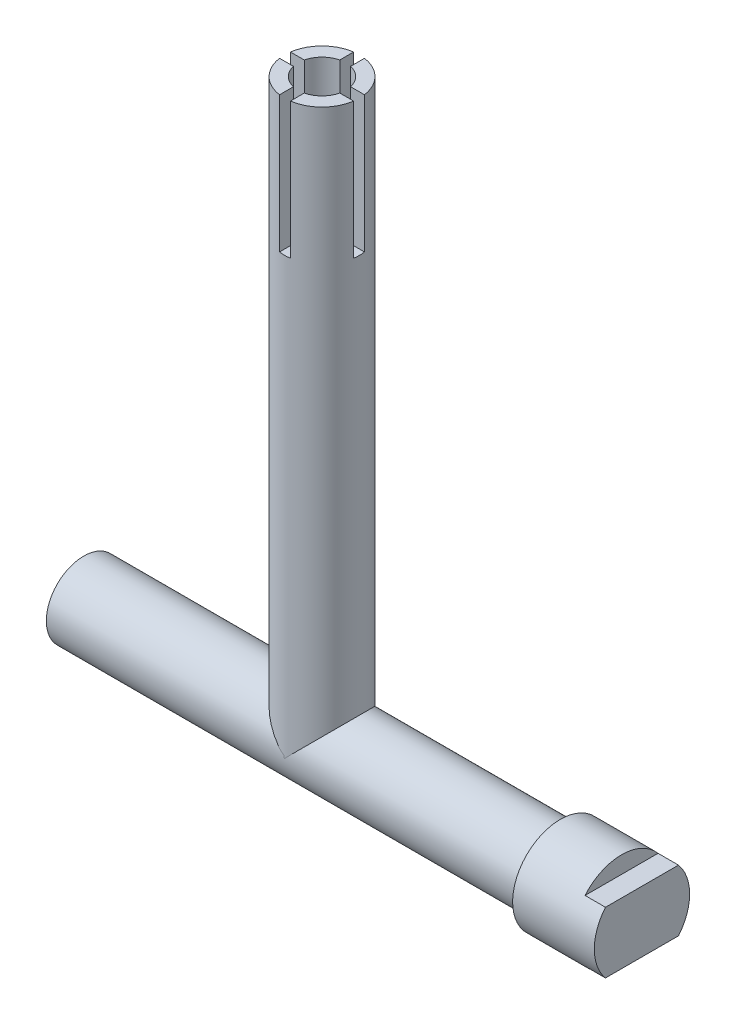
from build123d import *

# Parameters (mm, degrees)
SKETCH_1_R                 = 2.75
EXTRUDE_1_DEPTH            = 35
SKETCH_2_R                 = 2.75
EXTRUDE_2_DEPTH            = 42
SKETCH_4_W                 = 0.8
SKETCH_4_H                 = 0.8
CUT_EXTRUDE_1_DEPTH        = 10
SKETCH_5_R                 = 3.5
EXTRUDE_3_DEPTH            = 6
CUT_EXTRUDE_START          = -1.5
CUT_EXTRUDE_2_DEPTH        = 1.5
SKETCH_7_R                 = 2
CUT_EXTRUDE_3_DEPTH        = 7
SPLIT_START                = 14
SPLIT_BODIES_1_DEPTH       = 7
SPLIT_BODIES_1_2_OUTLINE_R = 2.75
SPLIT_BODIES_1_2_DEPTH     = 2.75
SPLIT_BODIES_1_3_DEPTH     = 7


with BuildPart() as part:
    # Эскиз1 → Бобышка-Вытянуть1 (new body)
    with BuildSketch(Plane(origin=(0, 0, 0), x_dir=(0, 0, -1), z_dir=(1, 0, 0))):
        Circle(SKETCH_1_R)
    extrude(amount=EXTRUDE_1_DEPTH)

    # Эскиз5 → Бобышка-Вытянуть3 (add)
    with BuildSketch(Plane(origin=(35, 0, 0), x_dir=(0, 0, -1), z_dir=(1, 0, 0))):
        Circle(SKETCH_5_R)
    extrude(amount=EXTRUDE_3_DEPTH)

    # Эскиз6 → Вырез-Вытянуть2 (cut)
    with BuildSketch(Plane(origin=(41, 0, 0), x_dir=(0, 0, -1), z_dir=(1, 0, 0)).offset(CUT_EXTRUDE_START)):
        with BuildLine():
            ThreePointArc((2.680951324, 2.25), (0, 3.5), (-2.680951324, 2.25))
            Line((-2.680951324, 2.25), (2.680951324, 2.25))
        make_face()
        with BuildLine():
            Line((2.680951324, -2.25), (-2.680951324, -2.25))
            ThreePointArc((-2.680951324, -2.25), (0, -3.5), (2.680951324, -2.25))
        make_face()
    extrude(amount=CUT_EXTRUDE_2_DEPTH, mode=Mode.SUBTRACT)

    # Эскиз7 → Вырез-Вытянуть3 (cut)
    with BuildSketch(Plane.ZY):
        Circle(SKETCH_7_R)
    extrude(amount=-CUT_EXTRUDE_3_DEPTH, mode=Mode.SUBTRACT)

    # Эскиз8 → Отверстие обработанное метчиком M2.5x0.451 (revolve, cut)
    with BuildSketch(Plane(origin=(7, 0, 0), x_dir=(0, 0, 1), z_dir=(0, 1, 0))):
        Polygon((0, 0), (0, 6.615882135), (1.025, 6), (1.025, 0), align=None)
    revolve(axis=Axis((0.65, 0, 0), (1, 0, 0)), mode=Mode.SUBTRACT)


with BuildPart() as body_2:
    # Эскиз2 → Бобышка-Вытянуть2 (new body)
    with BuildSketch(Plane(origin=(0, 0, 0), x_dir=(1, 0, 0), z_dir=(0, 1, 0))):
        with Locations(Location((17.5, 0, 0), (0, 0, 90))):
            Circle(SKETCH_2_R)
    extrude(amount=EXTRUDE_2_DEPTH)

    # Эскиз3 → Диаметр отверстия Ø3.5 (3.5)1 (revolve, cut)
    with BuildSketch(Plane(origin=(17.5, 42, 0), x_dir=(0, 0, 1), z_dir=(1, 0, 0))):
        Polygon((0, 0), (0, 14.051506083), (1.75, 13), (1.75, 0), align=None)
    revolve(axis=Axis((17.5, 48.35, 0), (0, -1, 0)), mode=Mode.SUBTRACT)

    # Эскиз4 → Вырез-Вытянуть1 (cut)
    with BuildSketch(Plane(origin=(0, 42, 0), x_dir=(1, 0, 0), z_dir=(0, 1, 0))):
        with BuildLine():
            Line((17.1, 4), (17.1, 2.720753572))
            ThreePointArc((17.1, 2.720753572), (17.5, 2.75), (17.9, 2.720753572))
            Line((17.9, 2.720753572), (17.9, 4))
            Line((17.9, 4), (17.1, 4))
        make_face()
        with BuildLine():
            Line((17.1, -1.703672504), (17.1, -2.720753572))
            ThreePointArc((17.1, -2.720753572), (17.5, -2.75), (17.9, -2.720753572))
            Line((17.9, -2.720753572), (17.9, -1.703672504))
            ThreePointArc((17.9, -1.703672504), (17.5, -1.75), (17.1, -1.703672504))
        make_face()
        with BuildLine():
            ThreePointArc((17.9, 2.720753572), (17.5, 2.75), (17.1, 2.720753572))
            Line((17.1, 2.720753572), (17.1, 1.703672504))
            ThreePointArc((17.1, 1.703672504), (17.5, 1.75), (17.9, 1.703672504))
            Line((17.9, 1.703672504), (17.9, 2.720753572))
        make_face()
        with BuildLine():
            Line((17.1, 1.703672504), (17.1, 0.4))
            Line((17.1, 0.4), (17.9, 0.4))
            Line((17.9, 0.4), (17.9, 1.703672504))
            ThreePointArc((17.9, 1.703672504), (17.5, 1.75), (17.1, 1.703672504))
        make_face()
        with Locations((17.5, 0)):
            Rectangle(SKETCH_4_W, SKETCH_4_H)
        with BuildLine():
            Line((15.796327496, -0.4), (17.1, -0.4))
            Line((17.1, -0.4), (17.1, 0.4))
            Line((17.1, 0.4), (15.796327496, 0.4))
            ThreePointArc((15.796327496, 0.4), (15.75, 0), (15.796327496, -0.4))
        make_face()
        with BuildLine():
            ThreePointArc((14.779246428, 0.4), (14.75, 0), (14.779246428, -0.4))
            Line((14.779246428, -0.4), (15.796327496, -0.4))
            ThreePointArc((15.796327496, -0.4), (15.75, 0), (15.796327496, 0.4))
            Line((15.796327496, 0.4), (14.779246428, 0.4))
        make_face()
        with BuildLine():
            Line((19.203672504, -0.4), (20.220753572, -0.4))
            ThreePointArc((20.220753572, -0.4), (20.242678647, -0.200533883), (20.25, 0))
            ThreePointArc((20.25, 0), (20.242678647, 0.200533883), (20.220753572, 0.4))
            Line((20.220753572, 0.4), (19.203672504, 0.4))
            ThreePointArc((19.203672504, 0.4), (19.238379545, 0.20133693), (19.25, 0))
            ThreePointArc((19.25, 0), (19.238379545, -0.20133693), (19.203672504, -0.4))
        make_face()
        with BuildLine():
            Line((13.5, -0.4), (14.779246428, -0.4))
            ThreePointArc((14.779246428, -0.4), (14.75, 0), (14.779246428, 0.4))
            Line((14.779246428, 0.4), (13.5, 0.4))
            Line((13.5, 0.4), (13.5, -0.4))
        make_face()
        with BuildLine():
            Line((17.1, -0.4), (17.1, -1.703672504))
            ThreePointArc((17.1, -1.703672504), (17.5, -1.75), (17.9, -1.703672504))
            Line((17.9, -1.703672504), (17.9, -0.4))
            Line((17.9, -0.4), (17.1, -0.4))
        make_face()
        with BuildLine():
            Line((17.1, -2.720753572), (17.1, -4))
            Line((17.1, -4), (17.9, -4))
            Line((17.9, -4), (17.9, -2.720753572))
            ThreePointArc((17.9, -2.720753572), (17.5, -2.75), (17.1, -2.720753572))
        make_face()
        with BuildLine():
            Line((17.9, 0.4), (17.9, -0.4))
            Line((17.9, -0.4), (19.203672504, -0.4))
            ThreePointArc((19.203672504, -0.4), (19.238379545, -0.20133693), (19.25, 0))
            ThreePointArc((19.25, 0), (19.238379545, 0.20133693), (19.203672504, 0.4))
            Line((19.203672504, 0.4), (17.9, 0.4))
        make_face()
        with BuildLine():
            ThreePointArc((20.25, 0), (20.242678647, -0.200533883), (20.220753572, -0.4))
            Line((20.220753572, -0.4), (21.5, -0.4))
            Line((21.5, -0.4), (21.5, 0.4))
            Line((21.5, 0.4), (20.220753572, 0.4))
            ThreePointArc((20.220753572, 0.4), (20.242678647, 0.200533883), (20.25, 0))
        make_face()
    extrude(amount=-CUT_EXTRUDE_1_DEPTH, mode=Mode.SUBTRACT)

    # Split Bodies 1: read off the stored shape, not the designer's step
    # Split Bodies 1 outline → Split Bodies 1 (cut)
    with BuildSketch(Plane.YZ.offset(SPLIT_START)):
        with BuildLine():
            ThreePointArc((0, -2.75), (2.75, 0), (0, 2.75))
            Line((0, 2.75), (0, -2.75))
        make_face()
    extrude(amount=SPLIT_BODIES_1_DEPTH, mode=Mode.SUBTRACT)


with BuildPart() as body_3:
    # Split Bodies 1 2 outline → Split Bodies 1 2 (new body)
    with BuildSketch(Plane(origin=(0, 0, 0), x_dir=(1, 0, 0), z_dir=(0, 1, 0))):
        with Locations((17.5, 0)):
            Circle(SPLIT_BODIES_1_2_OUTLINE_R)
    extrude(amount=SPLIT_BODIES_1_2_DEPTH)

    # Split Bodies 1 3 outline → Split Bodies 1 3 (cut)
    with BuildSketch(Plane.YZ.offset(SPLIT_START)):
        with BuildLine():
            Line((-1, 2.75), (0, 2.75))
            ThreePointArc((0, 2.75), (1.944543648, 1.944543648), (2.75, 0))
            Line((2.75, 0), (2.75, 4))
            Line((2.75, 4), (-1, 4))
            Line((-1, 4), (-1, 2.75))
        make_face()
        with BuildLine():
            Line((2.75, -4), (2.75, 0))
            ThreePointArc((2.75, 0), (1.944543648, -1.944543648), (0, -2.75))
            Line((0, -2.75), (-1, -2.75))
            Line((-1, -2.75), (-1, -4))
            Line((-1, -4), (2.75, -4))
        make_face()
    extrude(amount=SPLIT_BODIES_1_3_DEPTH, mode=Mode.SUBTRACT)


solid = Compound([part.part, body_2.part])
